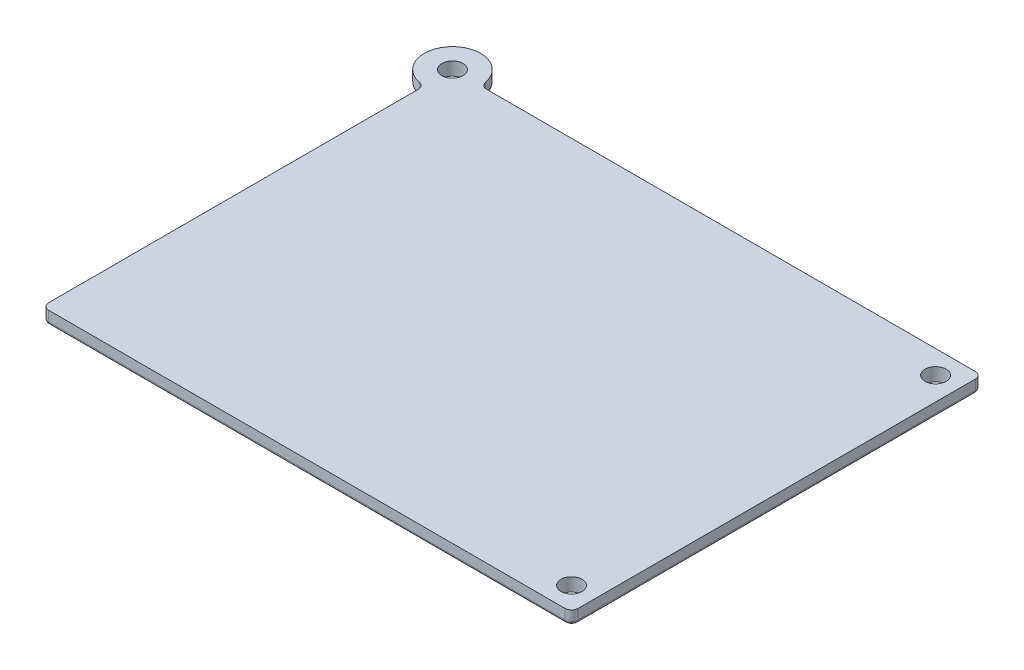
from build123d import *

# Parameters (mm, degrees)
MAIN_BODY_DEPTH        = 2
CORNERS_R              = 1
EDGE_2_R               = 0.5
LID_HOLES_DEPTH        = 57.609407345
LID_HOLES_DEPTH_BACK   = 57.609407345
SKETCH7_R              = 1.6
SKETCH4_R              = 2.325
BOSS_EXTRUDE3_DEPTH    = 1.6
FILLET3_R              = 0.05
LPATTERN5_COUNT        = 4
LPATTERN5_PITCH        = 8
FILLET3_OF_LPATTERN5_R = 0.05
SKETCH9_R              = 2.325
PEGS_DIAGONAL_DEPTH    = 1.6
FILLET6_R              = 0.05
LPATTERN6_COUNT        = 4
LPATTERN6_PITCH        = 8


with BuildPart() as part:
    # Sketch1 → Main Body (new body)
    with BuildSketch(Plane(origin=(0, 0, 0), x_dir=(1, 0, 0), z_dir=(0, 1, 0))):
        with BuildLine():
            Line((-40, -31), (40, -31))
            Line((40, -31), (40, 31))
            Line((40, 31), (-34.846117968, 31))
            ThreePointArc((-34.846117968, 31), (-35.482326978, 31.22848325), (-35.827809784, 31.80952381))
            ThreePointArc((-35.827809784, 31.80952381), (-43.00520382, 34.00520382), (-40.80952381, 26.827809784))
            ThreePointArc((-40.80952381, 26.827809784), (-40.22848325, 26.482326978), (-40, 25.846117968))
            Line((-40, 25.846117968), (-40, -31))
        make_face()
    extrude(amount=MAIN_BODY_DEPTH)

    # Corners
    corners_edges = [part.edges().sort_by_distance(p)[0] for p in [
        (-40, 1, 31),
        (40, 1, -31),
        (40, 1, 31),
    ]]
    fillet(corners_edges, radius=CORNERS_R)

    # Edge 2
    edge_2_edges = [part.edges().sort_by_distance(p)[0] for p in [
        (-39.707106781, 0, 30.707106781),
        (39.707106781, 0, -30.707106781),
        (39.707106781, 0, 30.707106781),
        (-40, 0, 2.076941016),
        (2.076941016, 0, -31),
        (40, 0, 0),
        (0, 0, 31),
        (-40.22848325, 0, -26.482326978),
        (-43.00520382, 0, -34.00520382),
        (-35.482326978, 0, -31.22848325),
    ]]
    fillet(edge_2_edges, radius=EDGE_2_R)

    # Sketch7 → Lid Holes (cut, two sides: drawn at the far end of the back side and taken through both)
    with BuildSketch(Plane(origin=(0, 0, 0), x_dir=(-1, 0, 0), z_dir=(0, -1, 0)).offset(-LID_HOLES_DEPTH_BACK)):
        with Locations((-36.5, 27.5)):
            Circle(SKETCH7_R)
        with Locations((-36.5, -27.5)):
            Circle(SKETCH7_R)
        with Locations((40, 31)):
            Circle(SKETCH7_R)
    extrude(amount=LID_HOLES_DEPTH + LID_HOLES_DEPTH_BACK, mode=Mode.SUBTRACT)

    # Sketch4 → Boss-Extrude3 (add)
    with BuildSketch(Plane(origin=(0, 0, 0), x_dir=(-1, 0, 0), z_dir=(0, -1, 0))):
        with Locations((-34.403805922, -19.746951673)):
            Circle(SKETCH4_R)
        with Locations((-28.746951673, -25.403805922)):
            Circle(SKETCH4_R)
    boss_extrude3 = extrude(amount=BOSS_EXTRUDE3_DEPTH)

    # Fillet3
    fillet3_edges = [part.edges().sort_by_distance(p)[0] for p in [
        (36.728805922, -1.6, 19.746951673),
        (31.071951673, -1.6, 25.403805922),
    ]]
    fillet(fillet3_edges, radius=FILLET3_R)

    # LPattern5: Boss-Extrude3 ×4
    with Locations(*[Vector(-0.7071067811865476, 0, -0.7071067811865476) * (i * LPATTERN5_PITCH) for i in range(1, LPATTERN5_COUNT)]):
        add(boss_extrude3)

    # Fillet3 of LPattern5
    fillet3_of_lpattern5_edges = [part.edges().sort_by_distance(p)[0] for p in [
        (31.071951673, -1.6, 14.090097423),
        (25.415097423, -1.6, 19.746951673),
        (25.415097423, -1.6, 8.433243174),
        (19.758243174, -1.6, 14.090097423),
        (19.758243174, -1.6, 2.776388924),
        (14.101388924, -1.6, 8.433243174),
    ]]
    fillet(fillet3_of_lpattern5_edges, radius=FILLET3_OF_LPATTERN5_R)

    # Sketch9 → Pegs (Diagonal) (add)
    with BuildSketch(Plane(origin=(0, 0, 0), x_dir=(-1, 0, 0), z_dir=(0, -1, 0))):
        with Locations((27.31698357, -25.389425923)):
            Circle(SKETCH9_R)
        with Locations((32.309292455, -19.138277869)):
            Circle(SKETCH9_R)
    pegs_diagonal = extrude(amount=PEGS_DIAGONAL_DEPTH)

    # Fillet6
    fillet6_edges = [part.edges().sort_by_distance(p)[0] for p in [
        (-24.99198357, -1.6, 25.389425923),
        (-29.984292455, -1.6, 19.138277869),
    ]]
    fillet(fillet6_edges, radius=FILLET6_R)

    # LPattern6: Pegs (Diagonal) ×4
    with Locations(*[Vector(0.7813935067873017, 0, -0.6240386106248901) * (i * LPATTERN6_PITCH) for i in range(1, LPATTERN6_COUNT)]):
        add(pegs_diagonal)


solid = part.part
